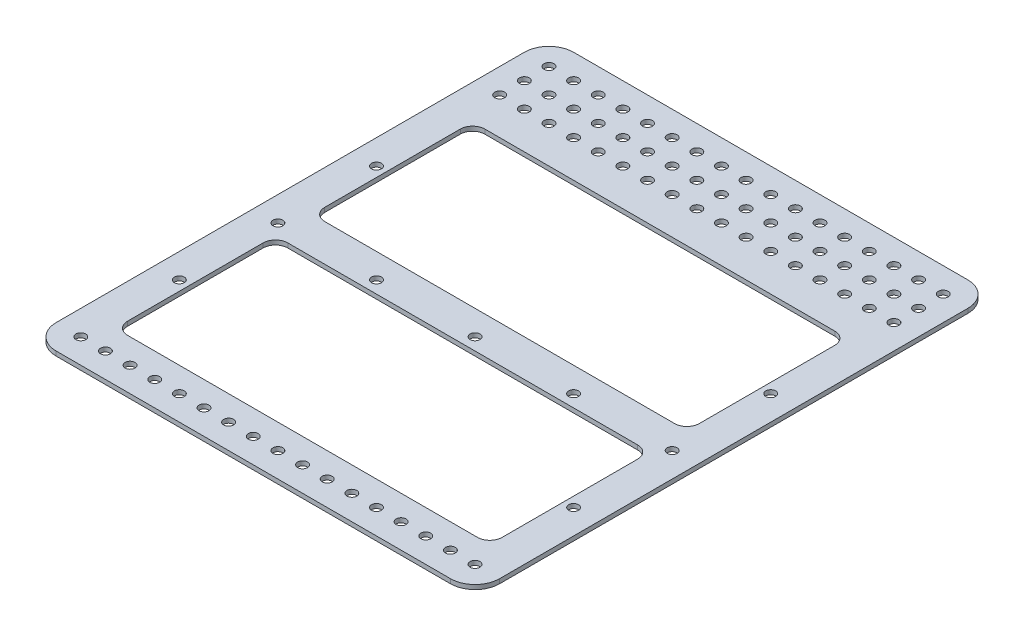
from build123d import *

# Parameters (mm, degrees)
SKETCH3_W           = 228.6
SKETCH3_H           = 266.7
SKETCH3_R           = 2.54
SKETCH3_W_2         = 193.04
SKETCH3_H_2         = 82.55
BOSS_EXTRUDE3_DEPTH = 2.286
FILLET5_R           = 12.7
FILLET6_R           = 6.35


with BuildPart() as part:
    # Sketch3 → Boss-Extrude3 (new body)
    with BuildSketch(Plane(origin=(0, 0, 0), x_dir=(1, 0, 0), z_dir=(0, 1, 0))):
        with Locations((114.3, 133.35)):
            Rectangle(SKETCH3_W, SKETCH3_H)
        with Locations((12.7, 254)):
            Circle(SKETCH3_R, mode=Mode.SUBTRACT)
        with Locations((25.4, 254)):
            Circle(SKETCH3_R, mode=Mode.SUBTRACT)
        with Locations((38.1, 254)):
            Circle(SKETCH3_R, mode=Mode.SUBTRACT)
        with Locations((50.8, 254)):
            Circle(SKETCH3_R, mode=Mode.SUBTRACT)
        with Locations((63.5, 254)):
            Circle(SKETCH3_R, mode=Mode.SUBTRACT)
        with Locations((76.2, 254)):
            Circle(SKETCH3_R, mode=Mode.SUBTRACT)
        with Locations((88.9, 254)):
            Circle(SKETCH3_R, mode=Mode.SUBTRACT)
        with Locations((101.6, 254)):
            Circle(SKETCH3_R, mode=Mode.SUBTRACT)
        with Locations((114.3, 254)):
            Circle(SKETCH3_R, mode=Mode.SUBTRACT)
        with Locations((127, 254)):
            Circle(SKETCH3_R, mode=Mode.SUBTRACT)
        with Locations((139.7, 254)):
            Circle(SKETCH3_R, mode=Mode.SUBTRACT)
        with Locations((152.4, 254)):
            Circle(SKETCH3_R, mode=Mode.SUBTRACT)
        with Locations((165.1, 254)):
            Circle(SKETCH3_R, mode=Mode.SUBTRACT)
        with Locations((177.8, 254)):
            Circle(SKETCH3_R, mode=Mode.SUBTRACT)
        with Locations((190.5, 254)):
            Circle(SKETCH3_R, mode=Mode.SUBTRACT)
        with Locations((203.2, 254)):
            Circle(SKETCH3_R, mode=Mode.SUBTRACT)
        with Locations((215.9, 254)):
            Circle(SKETCH3_R, mode=Mode.SUBTRACT)
        with Locations((25.4, 241.3)):
            Circle(SKETCH3_R, mode=Mode.SUBTRACT)
        with Locations((38.1, 241.3)):
            Circle(SKETCH3_R, mode=Mode.SUBTRACT)
        with Locations((50.8, 241.3)):
            Circle(SKETCH3_R, mode=Mode.SUBTRACT)
        with Locations((63.5, 241.3)):
            Circle(SKETCH3_R, mode=Mode.SUBTRACT)
        with Locations((76.2, 241.3)):
            Circle(SKETCH3_R, mode=Mode.SUBTRACT)
        with Locations((88.9, 241.3)):
            Circle(SKETCH3_R, mode=Mode.SUBTRACT)
        with Locations((101.6, 241.3)):
            Circle(SKETCH3_R, mode=Mode.SUBTRACT)
        with Locations((114.3, 241.3)):
            Circle(SKETCH3_R, mode=Mode.SUBTRACT)
        with Locations((127, 241.3)):
            Circle(SKETCH3_R, mode=Mode.SUBTRACT)
        with Locations((139.7, 241.3)):
            Circle(SKETCH3_R, mode=Mode.SUBTRACT)
        with Locations((152.4, 241.3)):
            Circle(SKETCH3_R, mode=Mode.SUBTRACT)
        with Locations((165.1, 241.3)):
            Circle(SKETCH3_R, mode=Mode.SUBTRACT)
        with Locations((177.8, 241.3)):
            Circle(SKETCH3_R, mode=Mode.SUBTRACT)
        with Locations((190.5, 241.3)):
            Circle(SKETCH3_R, mode=Mode.SUBTRACT)
        with Locations((203.2, 241.3)):
            Circle(SKETCH3_R, mode=Mode.SUBTRACT)
        with Locations((215.9, 241.3)):
            Circle(SKETCH3_R, mode=Mode.SUBTRACT)
        with Locations((25.4, 228.6)):
            Circle(SKETCH3_R, mode=Mode.SUBTRACT)
        with Locations((38.1, 228.6)):
            Circle(SKETCH3_R, mode=Mode.SUBTRACT)
        with Locations((50.8, 228.6)):
            Circle(SKETCH3_R, mode=Mode.SUBTRACT)
        with Locations((63.5, 228.6)):
            Circle(SKETCH3_R, mode=Mode.SUBTRACT)
        with Locations((76.2, 228.6)):
            Circle(SKETCH3_R, mode=Mode.SUBTRACT)
        with Locations((88.9, 228.6)):
            Circle(SKETCH3_R, mode=Mode.SUBTRACT)
        with Locations((101.6, 228.6)):
            Circle(SKETCH3_R, mode=Mode.SUBTRACT)
        with Locations((114.3, 228.6)):
            Circle(SKETCH3_R, mode=Mode.SUBTRACT)
        with Locations((127, 228.6)):
            Circle(SKETCH3_R, mode=Mode.SUBTRACT)
        with Locations((139.7, 228.6)):
            Circle(SKETCH3_R, mode=Mode.SUBTRACT)
        with Locations((152.4, 228.6)):
            Circle(SKETCH3_R, mode=Mode.SUBTRACT)
        with Locations((165.1, 228.6)):
            Circle(SKETCH3_R, mode=Mode.SUBTRACT)
        with Locations((177.8, 228.6)):
            Circle(SKETCH3_R, mode=Mode.SUBTRACT)
        with Locations((190.5, 228.6)):
            Circle(SKETCH3_R, mode=Mode.SUBTRACT)
        with Locations((203.2, 228.6)):
            Circle(SKETCH3_R, mode=Mode.SUBTRACT)
        with Locations((215.9, 228.6)):
            Circle(SKETCH3_R, mode=Mode.SUBTRACT)
        with Locations((12.7, 241.3)):
            Circle(SKETCH3_R, mode=Mode.SUBTRACT)
        with Locations((12.7, 228.6)):
            Circle(SKETCH3_R, mode=Mode.SUBTRACT)
        with Locations((12.7, 12.7)):
            Circle(SKETCH3_R, mode=Mode.SUBTRACT)
        with Locations((25.4, 12.7)):
            Circle(SKETCH3_R, mode=Mode.SUBTRACT)
        with Locations((38.1, 12.7)):
            Circle(SKETCH3_R, mode=Mode.SUBTRACT)
        with Locations((50.8, 12.7)):
            Circle(SKETCH3_R, mode=Mode.SUBTRACT)
        with Locations((63.5, 12.7)):
            Circle(SKETCH3_R, mode=Mode.SUBTRACT)
        with Locations((76.2, 12.7)):
            Circle(SKETCH3_R, mode=Mode.SUBTRACT)
        with Locations((88.9, 12.7)):
            Circle(SKETCH3_R, mode=Mode.SUBTRACT)
        with Locations((101.6, 12.7)):
            Circle(SKETCH3_R, mode=Mode.SUBTRACT)
        with Locations((114.3, 12.7)):
            Circle(SKETCH3_R, mode=Mode.SUBTRACT)
        with Locations((127, 12.7)):
            Circle(SKETCH3_R, mode=Mode.SUBTRACT)
        with Locations((139.7, 12.7)):
            Circle(SKETCH3_R, mode=Mode.SUBTRACT)
        with Locations((152.4, 12.7)):
            Circle(SKETCH3_R, mode=Mode.SUBTRACT)
        with Locations((165.1, 12.7)):
            Circle(SKETCH3_R, mode=Mode.SUBTRACT)
        with Locations((177.8, 12.7)):
            Circle(SKETCH3_R, mode=Mode.SUBTRACT)
        with Locations((190.5, 12.7)):
            Circle(SKETCH3_R, mode=Mode.SUBTRACT)
        with Locations((203.2, 12.7)):
            Circle(SKETCH3_R, mode=Mode.SUBTRACT)
        with Locations((215.9, 12.7)):
            Circle(SKETCH3_R, mode=Mode.SUBTRACT)
        with Locations((12.7, 114.3)):
            Circle(SKETCH3_R, mode=Mode.SUBTRACT)
        with Locations((63.5, 114.3)):
            Circle(SKETCH3_R, mode=Mode.SUBTRACT)
        with Locations((114.3, 114.3)):
            Circle(SKETCH3_R, mode=Mode.SUBTRACT)
        with Locations((165.1, 114.3)):
            Circle(SKETCH3_R, mode=Mode.SUBTRACT)
        with Locations((215.9, 114.3)):
            Circle(SKETCH3_R, mode=Mode.SUBTRACT)
        with Locations((12.7, 165.1)):
            Circle(SKETCH3_R, mode=Mode.SUBTRACT)
        with Locations((215.9, 165.1)):
            Circle(SKETCH3_R, mode=Mode.SUBTRACT)
        with Locations((12.7, 63.5)):
            Circle(SKETCH3_R, mode=Mode.SUBTRACT)
        with Locations((215.9, 63.5)):
            Circle(SKETCH3_R, mode=Mode.SUBTRACT)
        with Locations((114.3, 66.675)):
            Rectangle(SKETCH3_W_2, SKETCH3_H_2, mode=Mode.SUBTRACT)
        with Locations((114.3, 168.275)):
            Rectangle(SKETCH3_W_2, SKETCH3_H_2, mode=Mode.SUBTRACT)
    extrude(amount=BOSS_EXTRUDE3_DEPTH)

    # Fillet5
    fillet5_edges = [part.edges().sort_by_distance(p)[0] for p in [
        (0, 1.143, -266.7),
        (228.6, 1.143, -266.7),
        (228.6, 1.143, 0),
        (0, 1.143, 0),
    ]]
    fillet(fillet5_edges, radius=FILLET5_R)

    # Fillet6
    fillet6_edges = [part.edges().sort_by_distance(p)[0] for p in [
        (17.78, 1.143, -127),
        (210.82, 1.143, -127),
        (210.82, 1.143, -209.55),
        (17.78, 1.143, -209.55),
        (17.78, 1.143, -107.95),
        (17.78, 1.143, -25.4),
        (210.82, 1.143, -25.4),
        (210.82, 1.143, -107.95),
    ]]
    fillet(fillet6_edges, radius=FILLET6_R)


solid = part.part
